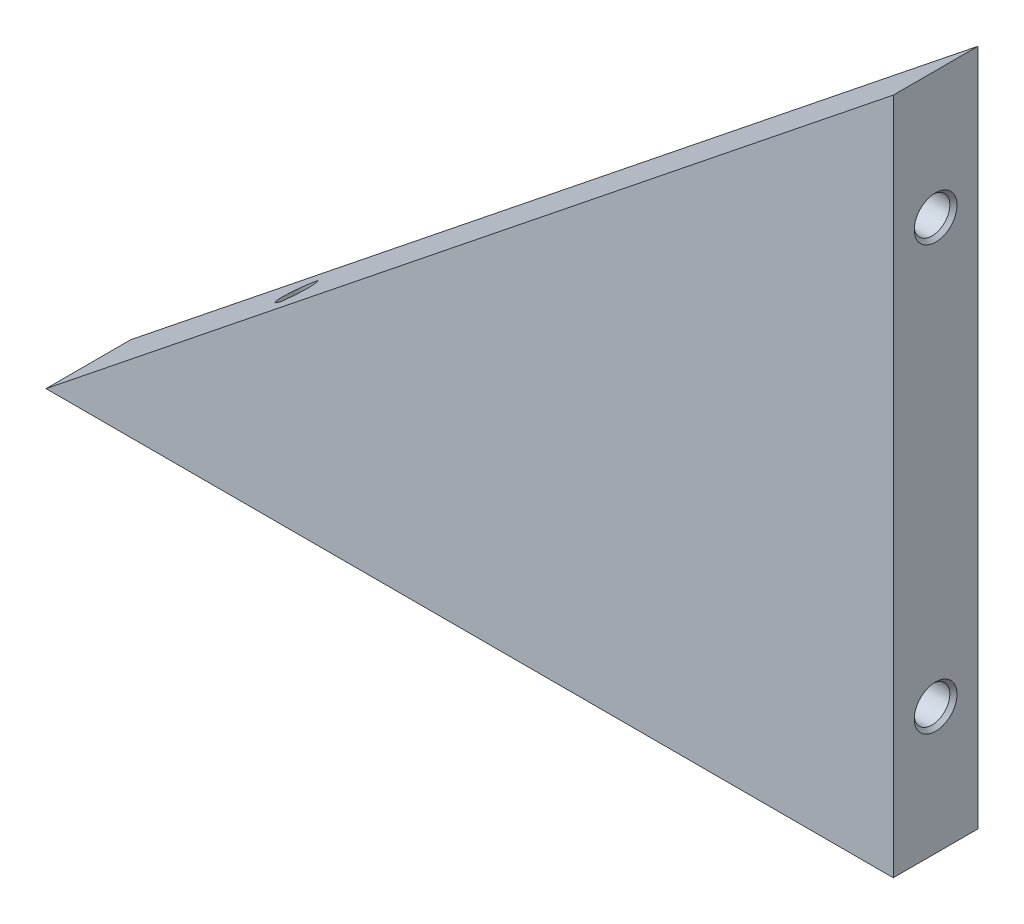
from build123d import *

# Parameters (mm, degrees)
AUFSATZ_LINEAR_AUSTRAGEN1_DEPTH = 10
M5_GEWINDEBOHRUNG2_D            = 4.2
M5_GEWINDEBOHRUNG2_DEPTH        = 15
M5_GEWINDEBOHRUNG2_CSINK_D      = 5.05
M5_GEWINDEBOHRUNG2_CSINK_ANGLE  = 90
M5_GEWINDEBOHRUNG2_TIP          = 1.2618073
M5_GEWINDEBOHRUNG3_D            = 4.2
M5_GEWINDEBOHRUNG3_DEPTH        = 20
M5_GEWINDEBOHRUNG3_CSINK_D      = 5.05
M5_GEWINDEBOHRUNG3_CSINK_ANGLE  = 90
M5_GEWINDEBOHRUNG3_TIP          = 1.2618073


with BuildPart() as part:
    # Skizze1 → Aufsatz-Linear austragen1 (new body)
    with BuildSketch(Plane.XY):
        Polygon((100, 0), (100, 80), (0, 0), align=None)
    extrude(amount=AUFSATZ_LINEAR_AUSTRAGEN1_DEPTH)

    # M5 Gewindebohrung2
    with Locations(Plane(origin=(100, 0, 0), x_dir=(0, 0, -1), z_dir=(1, 0, 0))):
        with Locations((-5, 65), (-5, 15)):
            CounterSinkHole(M5_GEWINDEBOHRUNG2_D / 2, M5_GEWINDEBOHRUNG2_CSINK_D / 2, depth=M5_GEWINDEBOHRUNG2_DEPTH, counter_sink_angle=M5_GEWINDEBOHRUNG2_CSINK_ANGLE)
            with Locations((0, 0, -(M5_GEWINDEBOHRUNG2_DEPTH + M5_GEWINDEBOHRUNG2_TIP / 2))):  # 118° drill point
                Cone(0, M5_GEWINDEBOHRUNG2_D / 2, M5_GEWINDEBOHRUNG2_TIP, mode=Mode.SUBTRACT)

    # M5 Gewindebohrung3
    with Locations(Plane(origin=(0, 0, 0), x_dir=(-1, 0, 0), z_dir=(0, -1, 0))):
        with Locations((-25, -5), (-75, -5)):
            CounterSinkHole(M5_GEWINDEBOHRUNG3_D / 2, M5_GEWINDEBOHRUNG3_CSINK_D / 2, depth=M5_GEWINDEBOHRUNG3_DEPTH, counter_sink_angle=M5_GEWINDEBOHRUNG3_CSINK_ANGLE)
            with Locations((0, 0, -(M5_GEWINDEBOHRUNG3_DEPTH + M5_GEWINDEBOHRUNG3_TIP / 2))):  # 118° drill point
                Cone(0, M5_GEWINDEBOHRUNG3_D / 2, M5_GEWINDEBOHRUNG3_TIP, mode=Mode.SUBTRACT)


solid = part.part
